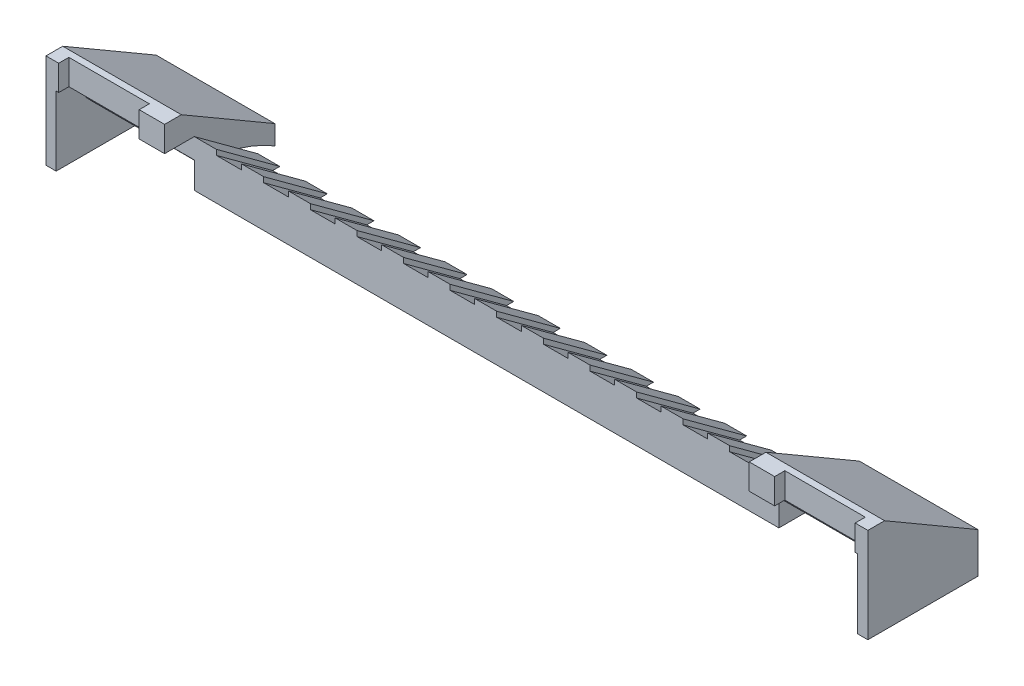
from build123d import *

# Parameters (mm, degrees)
BOSS_EXTRUDE1_DEPTH    = 2.6
BOSS_EXTRUDE2_START    = -2.6
BOSS_EXTRUDE2_DEPTH    = 69
BOSS_EXTRUDE3_START    = 3.2
BOSS_EXTRUDE3_DEPTH    = 2.6
FILL_START             = -63.4
FILL_PATTERN1_DEPTH    = 2.6
FILL_START_2           = -57.9
FILL_PATTERN1_2_DEPTH  = 2.6
FILL_START_3           = -52.4
FILL_PATTERN1_3_DEPTH  = 2.6
FILL_START_4           = -46.9
FILL_PATTERN1_4_DEPTH  = 2.6
FILL_START_5           = -41.4
FILL_PATTERN1_5_DEPTH  = 2.6
FILL_START_6           = -35.9
FILL_PATTERN1_6_DEPTH  = 2.6
FILL_START_7           = -30.4
FILL_PATTERN1_7_DEPTH  = 2.6
FILL_START_8           = -24.9
FILL_PATTERN1_8_DEPTH  = 2.6
FILL_START_9           = -19.4
FILL_PATTERN1_9_DEPTH  = 2.6
FILL_START_10          = -13.9
FILL_PATTERN1_10_DEPTH = 2.6
BOSS_EXTRUDE4_DEPTH    = 14
BOSS_EXTRUDE5_DEPTH    = 1.2
SKETCH6_W              = 9.5
SKETCH6_H              = 1.2
CUT_EXTRUDE1_DEPTH     = 3
CHAMFER1_START         = -1
CHAMFER1_DEPTH         = 3.165267299


with BuildPart() as part:
    # Sketch2 → Boss-Extrude1 (new body)
    with BuildSketch(Plane(origin=(0, 0, 0), x_dir=(0, 0, -1), z_dir=(1, 0, 0))):
        Polygon((0, 0), (0, 5.5), (7.5, 0), align=None)
    boss_extrude1 = extrude(amount=-BOSS_EXTRUDE1_DEPTH)

    # Sketch3 → Boss-Extrude2 (add)
    with BuildSketch(Plane.ZY.offset(2.6).offset(BOSS_EXTRUDE2_START)):
        Polygon((0, 0), (0, 4.879964159), (-6.65449658, 0), align=None)
    extrude(amount=BOSS_EXTRUDE2_DEPTH)

    # Sketch3<3> → Boss-Extrude3 (add)
    with BuildSketch(Plane.ZY.offset(2.6).offset(BOSS_EXTRUDE3_START)):
        Polygon((-6.65449658, 0), (0, 4.879964159), (0, 5.5), (-7.5, 0), align=None)
    extrude(amount=BOSS_EXTRUDE3_DEPTH)

    # Mirror1: Boss-Extrude1 across plane
    add(boss_extrude1.mirror(Plane(origin=(-34.5, 0, 0), x_dir=(0, 0, 1), z_dir=(1, 0, 0))))

    # Fill Pattern1: read off the stored shape, not the designer's step
    # Fill Pattern1 outline → Fill Pattern1 (add)
    with BuildSketch(Plane.YZ.offset(FILL_START)):
        Polygon((4.879964159, 0), (0, -6.65449658), (0, -7.5), (5.5, 0), align=None)
    extrude(amount=FILL_PATTERN1_DEPTH)

    # Fill Pattern1 2 outline → Fill Pattern1 2 (add)
    with BuildSketch(Plane.YZ.offset(FILL_START_2)):
        Polygon((4.879964159, 0), (0, -6.65449658), (0, -7.5), (5.5, 0), align=None)
    extrude(amount=FILL_PATTERN1_2_DEPTH)

    # Fill Pattern1 3 outline → Fill Pattern1 3 (add)
    with BuildSketch(Plane.YZ.offset(FILL_START_3)):
        Polygon((4.879964159, 0), (0, -6.65449658), (0, -7.5), (5.5, 0), align=None)
    extrude(amount=FILL_PATTERN1_3_DEPTH)

    # Fill Pattern1 4 outline → Fill Pattern1 4 (add)
    with BuildSketch(Plane.YZ.offset(FILL_START_4)):
        Polygon((4.879964159, 0), (0, -6.65449658), (0, -7.5), (5.5, 0), align=None)
    extrude(amount=FILL_PATTERN1_4_DEPTH)

    # Fill Pattern1 5 outline → Fill Pattern1 5 (add)
    with BuildSketch(Plane.YZ.offset(FILL_START_5)):
        Polygon((4.879964159, 0), (0, -6.65449658), (0, -7.5), (5.5, 0), align=None)
    extrude(amount=FILL_PATTERN1_5_DEPTH)

    # Fill Pattern1 6 outline → Fill Pattern1 6 (add)
    with BuildSketch(Plane.YZ.offset(FILL_START_6)):
        Polygon((4.879964159, 0), (0, -6.65449658), (0, -7.5), (5.5, 0), align=None)
    extrude(amount=FILL_PATTERN1_6_DEPTH)

    # Fill Pattern1 7 outline → Fill Pattern1 7 (add)
    with BuildSketch(Plane.YZ.offset(FILL_START_7)):
        Polygon((4.879964159, 0), (0, -6.65449658), (0, -7.5), (5.5, 0), align=None)
    extrude(amount=FILL_PATTERN1_7_DEPTH)

    # Fill Pattern1 8 outline → Fill Pattern1 8 (add)
    with BuildSketch(Plane.YZ.offset(FILL_START_8)):
        Polygon((4.879964159, 0), (0, -6.65449658), (0, -7.5), (5.5, 0), align=None)
    extrude(amount=FILL_PATTERN1_8_DEPTH)

    # Fill Pattern1 9 outline → Fill Pattern1 9 (add)
    with BuildSketch(Plane.YZ.offset(FILL_START_9)):
        Polygon((4.879964159, 0), (0, -6.65449658), (0, -7.5), (5.5, 0), align=None)
    extrude(amount=FILL_PATTERN1_9_DEPTH)

    # Fill Pattern1 10 outline → Fill Pattern1 10 (add)
    with BuildSketch(Plane.YZ.offset(FILL_START_10)):
        Polygon((4.879964159, 0), (0, -6.65449658), (0, -7.5), (5.5, 0), align=None)
    extrude(amount=FILL_PATTERN1_10_DEPTH)

    # Sketch4 → Boss-Extrude4 (add)
    with BuildSketch(Plane.ZY.offset(69)):
        with BuildLine():
            Line((0, 2.406191741), (0, 4.879964159))
            Line((0, 4.879964159), (-3.932237623, 1.996323235))
            ThreePointArc((-3.932237623, 1.996323235), (-1.977221876, 2.307779179), (0, 2.406191741))
        make_face()
        with BuildLine():
            Line((0, 4.879964159), (0, 5.5))
            Line((0, 5.5), (-5.225299515, 1.668113689))
            ThreePointArc((-5.225299515, 1.668113689), (-4.581760916, 1.844007543), (-3.932237623, 1.996323235))
            Line((-3.932237623, 1.996323235), (0, 4.879964159))
        make_face()
        with BuildLine():
            Line((-5.225299515, 1.668113689), (0, 5.5))
            Line((0, 5.5), (3.5, 5.5))
            Line((3.5, 5.5), (3.5, 8.5))
            Line((3.5, 8.5), (1.525445934, 8.5))
            Line((1.525445934, 8.5), (-9.5, 2.081639323))
            Line((-9.5, 2.081639323), (-9.5, -0.204677967))
            ThreePointArc((-9.5, -0.204677967), (-7.422606569, 0.868570996), (-5.225299515, 1.668113689))
        make_face()
    boss_extrude4 = extrude(amount=BOSS_EXTRUDE4_DEPTH)

    # Sketch5 → Boss-Extrude5 (add)
    with BuildSketch(Plane.ZY.offset(83)):
        Polygon((3.5, 8.5), (1.525445934, 8.5), (-9.5, 2.081639323), (-9.5, -2.683513675), (3.5, -2.683513675), align=None)
    boss_extrude5 = extrude(amount=-BOSS_EXTRUDE5_DEPTH)

    # Sketch6 → Cut-Extrude1 (cut)
    with BuildSketch(Plane(origin=(0, 8.5, 0), x_dir=(1, 0, 0), z_dir=(0, 1, 0))):
        with Locations((-76.75, -2.9)):
            Rectangle(SKETCH6_W, SKETCH6_H)
    cut_extrude1 = extrude(amount=-CUT_EXTRUDE1_DEPTH, mode=Mode.SUBTRACT)

    # Chamfer1: read off the stored shape, not the designer's step
    # Chamfer1 outline → Chamfer1 (cut)
    with BuildSketch(Plane(origin=(0, 0, 0), x_dir=(1, 0, 0), z_dir=(0, 0.6951264470531402, -0.7188874895331522)).offset(CHAMFER1_START)):
        Polygon((-69, -1.239281183), (-81.8, -1.239281183), (-81.8, -2.239281185), (-69, -2.239281183), align=None)
    chamfer1 = extrude(amount=CHAMFER1_DEPTH, mode=Mode.SUBTRACT)

    # Mirror2: Boss-Extrude4, Boss-Extrude5, Cut-Extrude1, Chamfer1 across plane
    add(boss_extrude4.mirror(Plane(origin=(-34.5, 0, 0), x_dir=(0, 0, 1), z_dir=(1, 0, 0))))
    add(boss_extrude5.mirror(Plane(origin=(-34.5, 0, 0), x_dir=(0, 0, 1), z_dir=(1, 0, 0))))
    add(cut_extrude1.mirror(Plane(origin=(-34.5, 0, 0), x_dir=(0, 0, 1), z_dir=(1, 0, 0))), mode=Mode.SUBTRACT)
    add(chamfer1.mirror(Plane(origin=(-34.5, 0, 0), x_dir=(0, 0, 1), z_dir=(1, 0, 0))), mode=Mode.SUBTRACT)


solid = part.part
